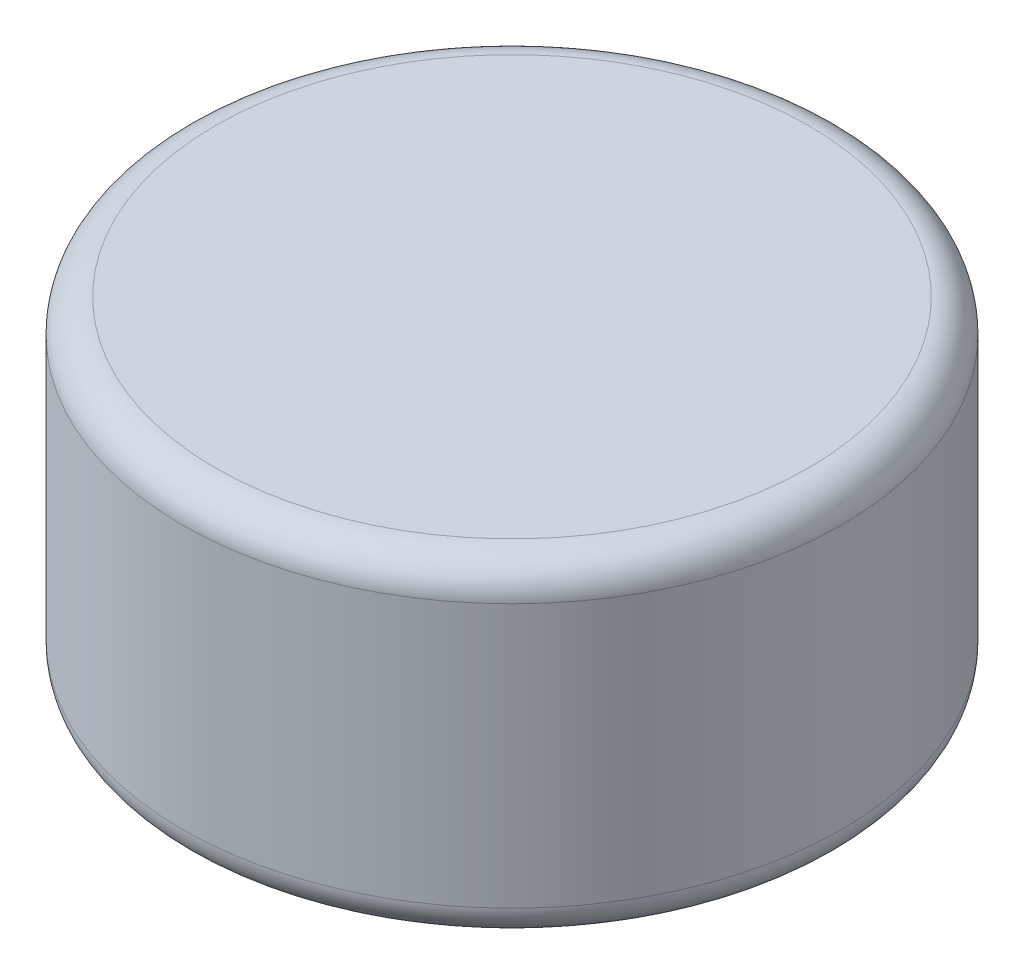
from build123d import *

# Parameters (mm, degrees)
SKETCH1_R           = 3.175
BOSS_EXTRUDE1_DEPTH = 1.5875
FILLET1_R           = 0.3175


with BuildPart() as part:
    # Sketch1 → Boss-Extrude1 (new, symmetric)
    with BuildSketch(Plane(origin=(0, 0, 0), x_dir=(1, 0, 0), z_dir=(0, 1, 0))):
        Circle(SKETCH1_R)
    extrude(amount=BOSS_EXTRUDE1_DEPTH, both=True)

    # Fillet1
    fillet1_edges = [part.edges().sort_by_distance(p)[0] for p in [
        (-3.175, -1.5875, 0),
        (-3.175, 1.5875, 0),
    ]]
    fillet(fillet1_edges, radius=FILLET1_R)


solid = part.part
